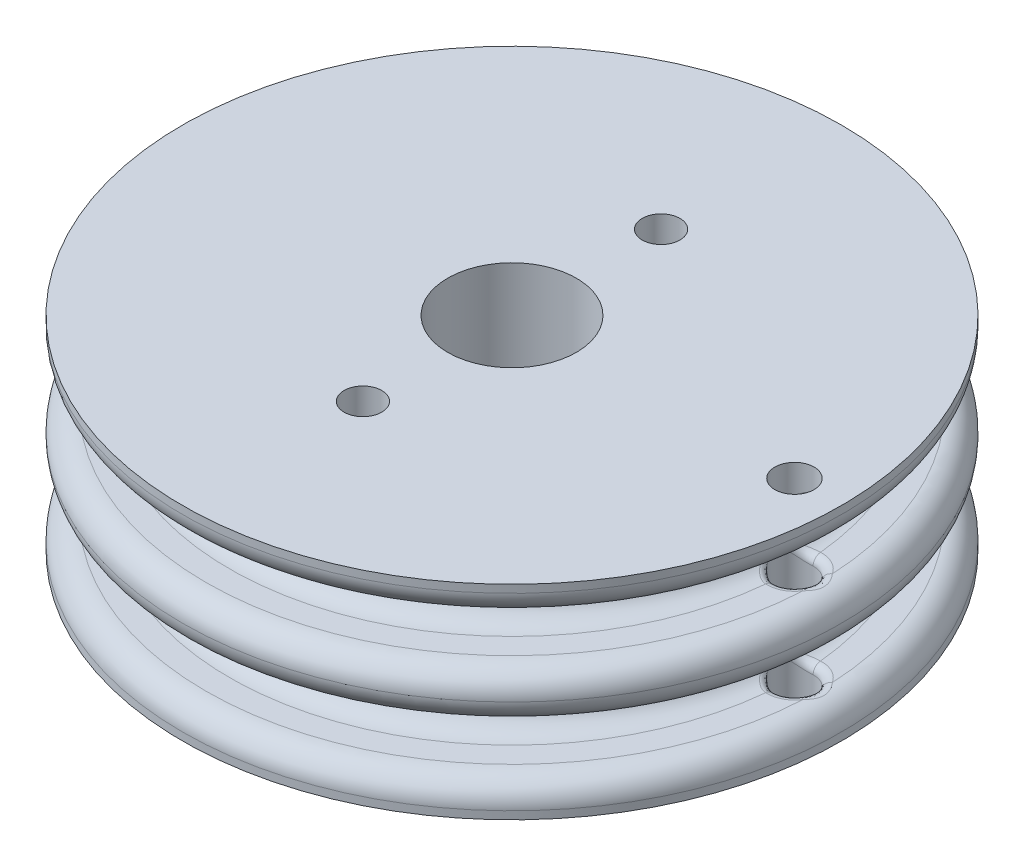
from build123d import *

# Parameters (mm, degrees)
CONG_1_R                = 1.5
ESQUISSE2_R             = 1.25
ESQUISSE2_R_2           = 1.2
ESQUISSE2_R_3           = 4.1
ENL_V_MAT_EXTRU_1_DEPTH = 33.41913022
CONG_3_R                = 0.5


with BuildPart() as part:
    # Esquisse1 → Révolution1 (revolve)
    with BuildSketch(Plane.XY, mode=Mode.PRIVATE) as r_volution1_sk:
        with BuildLine():
            Line((0, 0), (0, 13))
            Line((0, 13), (21, 13))
            Line((21, 13), (21, 11))
            Line((21, 11), (18, 11))
            ThreePointArc((18, 11), (16.5, 9.5), (18, 8))
            Line((18, 8), (21, 8))
            Line((21, 8), (21, 5))
            Line((21, 5), (18, 5))
            ThreePointArc((18, 5), (16.5, 3.5), (18, 2))
            Line((18, 2), (21, 2))
            Line((21, 2), (21, 0))
            Line((21, 0), (0, 0))
        make_face()
    revolve(r_volution1_sk.sketch.rotate(Axis((0, 13, 0), (0, 1, 0)), 90), axis=Axis((0, 13, 0), (0, 1, 0)))

    # Congé1
    cong_1_edges = [part.edges().sort_by_distance(p)[0] for p in [
        (0, 8, 21),
        (0, 5, 21),
        (0, 2, 21),
        (0, 11, 21),
    ]]
    fillet(cong_1_edges, radius=CONG_1_R - 0.0001)  # a hair under: the kernel refuses the full size

    # Esquisse2 → Enlèv. mat.-Extru.1 (cut, through all)
    with BuildSketch(Plane(origin=(0, 13, 0), x_dir=(1, 0, 0), z_dir=(0, 1, 0))):
        with Locations(Location((18, 0, 0), (0, 0, 270))):
            Circle(ESQUISSE2_R)
        with Locations(Location((0, -9.5, 0), (0, 0, 270))):
            Circle(ESQUISSE2_R_2)
        with Locations(Location((0, 0, 0), (0, 0, 270))):
            Circle(ESQUISSE2_R_3)
        with Locations(Location((0, 9.5, 0), (0, 0, 270))):
            Circle(ESQUISSE2_R_2)
    extrude(amount=-ENL_V_MAT_EXTRU_1_DEPTH, mode=Mode.SUBTRACT)

    # Congé3
    cong_3_edges = [part.edges().sort_by_distance(p)[0] for p in [
        (19.249811549, 5, -0.021704661),
        (16.749999998, 4.329156219, 2e-09),
        (16.749999998, 2.670843781, -2e-09),
        (19.249811549, 2, -0.021704661),
        (19.249811549, 11, -0.021704661),
        (16.749999998, 10.329156219, 2e-09),
        (16.749999998, 8.670843781, -2e-09),
        (19.249811549, 8, -0.021704661),
    ]]
    fillet(cong_3_edges, radius=CONG_3_R)


solid = part.part
